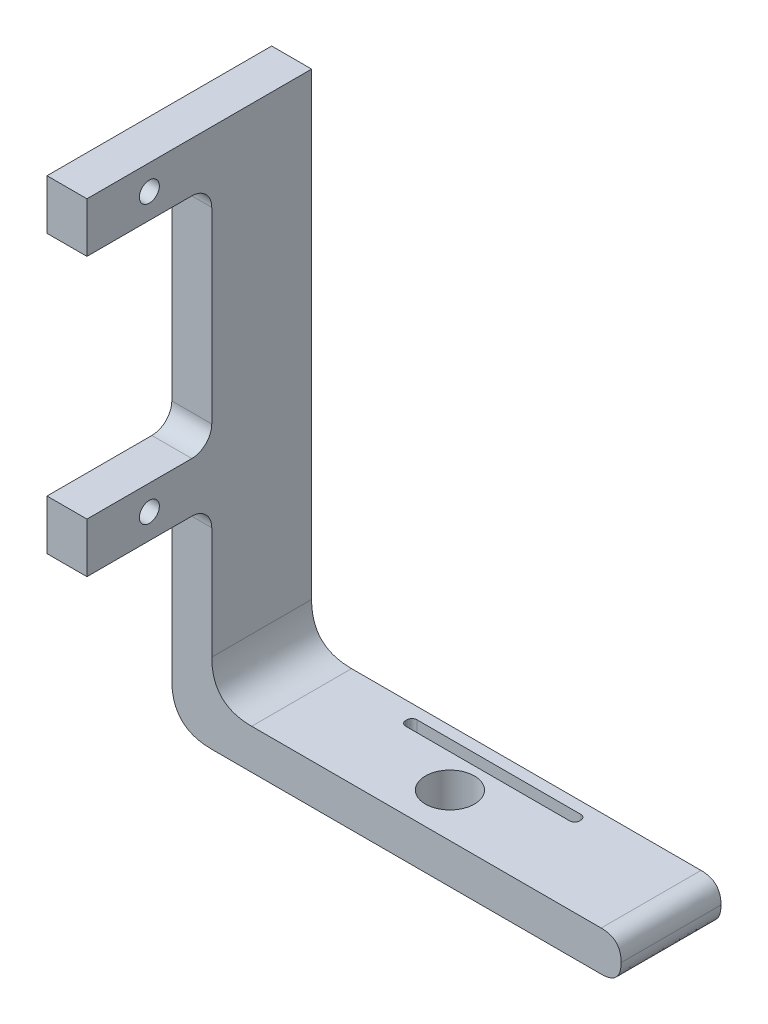
from build123d import *

# Parameters (mm, degrees)
SKETCH_1_W          = 4
SKETCH_1_H          = 50
SKETCH_1_W_2        = 45
SKETCH_1_H_2        = 4
EXTRUDE_1_DEPTH     = 10
SKETCH_2_W          = 4
SKETCH_2_H          = 5
EXTRUDE_2_DEPTH     = 12.5
SKETCH_3_R          = 1
CUT_EXTRUDE_1_DEPTH = 4
FILLET_1_DEPTH      = 10
FILLET_2_SIZE       = 4
FILLET_3_SIZE       = 2
FILLET_4_SIZE       = 2
SKETCH_27_R         = 1.552273675
CUT_EXTRUDE_2_DEPTH = 4
CUT_EXTRUDE_2_DRAFT = -7.86
FILLET_5_R          = 2
FILLET_6_R          = 2
FILLET_7_R          = 2
SKETCH_32_W         = 17.415964898
SKETCH_32_H         = 1.123035165
CUT_EXTRUDE_3_DEPTH = 4
SKETCH_26_R         = 2.45
CUT_EXTRUDE3_DEPTH  = 10
FILLET1_R           = 0.5
FILLET2_R           = 0.5
FILLET3_R           = 0.5
FILLET4_R           = 0.5


with BuildPart() as part:
    # Эскиз1 → Бобышка-Вытянуть1 (new body)
    with BuildSketch(Plane.XY):
        with Locations((2, 29)):
            Rectangle(SKETCH_1_W, SKETCH_1_H)
        with Locations((22.5, 2)):
            Rectangle(SKETCH_1_W_2, SKETCH_1_H_2)
    extrude(amount=EXTRUDE_1_DEPTH)

    # Эскиз2 → Бобышка-Вытянуть2 (add)
    with BuildSketch(Plane.XY.offset(10)):
        with Locations((2, 51.5)):
            Rectangle(SKETCH_2_W, SKETCH_2_H)
        with Locations((2, 23.72)):
            Rectangle(SKETCH_2_W, SKETCH_2_H)
    extrude(amount=EXTRUDE_2_DEPTH)

    # Эскиз3 → Вырез-Вытянуть1 (cut)
    with BuildSketch(Plane(origin=(4, 0, 0), x_dir=(0, 0, -1), z_dir=(1, 0, 0))):
        with Locations((-16.25, 51.5)):
            Circle(SKETCH_3_R)
        with Locations((-16.25, 23.72)):
            Circle(SKETCH_3_R)
    extrude(amount=-CUT_EXTRUDE_1_DEPTH, mode=Mode.SUBTRACT)

    # Скругление1: read off the stored shape, not the designer's step
    # Скругление1 outline → Скругление1 (add)
    with BuildSketch(Plane.XY):
        with BuildLine():
            Line((4, 4), (8, 4))
            add(Edge.make_bspline(
                [(8, 4), (4, 4), (4, 8)],
                knots=[0, 0, 0, 1, 1, 1], degree=2))
            Line((4, 8), (4, 4))
        make_face()
    extrude(amount=FILLET_1_DEPTH)

    # Скругление2
    # a fillet whose section is not a circle: 4 mm, written as the material it takes off along each edge
    with BuildSketch(Plane(origin=(0, 0, -10), x_dir=(0, 1, 0), z_dir=(0, 0, 1))) as fillet_2_piece_1:
        with BuildLine():
            Bezier((FILLET_2_SIZE, 0), (0, 0), (0, -FILLET_2_SIZE), weights=[1, 1, 1])
            Line((0, -FILLET_2_SIZE), (0, 0))
            Line((0, 0), (FILLET_2_SIZE, 0))
        make_face()
    extrude(amount=30, mode=Mode.SUBTRACT)

    # Скругление3
    # a fillet whose section is not a circle: 2 mm, written as the material it takes off along each edge
    with BuildSketch(Plane(origin=(45, 4, -5), x_dir=(-1, 0, 0), z_dir=(0, 0, 1))) as fillet_3_piece_1:
        with BuildLine():
            Bezier((FILLET_3_SIZE, 0), (0, 0), (0, FILLET_3_SIZE), weights=[1, 1, 1])
            Line((0, FILLET_3_SIZE), (0, 0))
            Line((0, 0), (FILLET_3_SIZE, 0))
        make_face()
    extrude(amount=20, mode=Mode.SUBTRACT)

    # Скругление4
    # a fillet whose section is not a circle: 2 mm, written as the material it takes off along each edge
    with BuildSketch(Plane(origin=(45, 0, -5), x_dir=(0, 1, 0), z_dir=(0, 0, 1))) as fillet_4_piece_1:
        with BuildLine():
            Bezier((FILLET_4_SIZE, 0), (0, 0), (0, FILLET_4_SIZE), weights=[1, 1, 1])
            Line((0, FILLET_4_SIZE), (0, 0))
            Line((0, 0), (FILLET_4_SIZE, 0))
        make_face()
    extrude(amount=20, mode=Mode.SUBTRACT)


with BuildPart() as cut_extrude_2_tool:
    # Эскиз27 → Вырез-Вытянуть2 (with draft: the straight prism first)
    with BuildSketch(Plane(origin=(0, 4, 0), x_dir=(1, 0, 0), z_dir=(0, 1, 0))):
        with Locations((23.455175104, -5.602717063)):
            Circle(SKETCH_27_R)
    extrude(amount=-CUT_EXTRUDE_2_DEPTH)
    # Вырез-Вытянуть2: the draft: its side faces are tilted about the plane it starts from
    cut_extrude_2_sides = [cut_extrude_2_tool.faces().sort_by_distance(p)[0] for p in [
        (21.902901429, 2, 5.602717063),
    ]]
    draft(cut_extrude_2_sides, Plane(origin=(0, 4, 0), x_dir=(1, 0, 0), z_dir=(0, 1, 0)), CUT_EXTRUDE_2_DRAFT)


with BuildPart() as part_1:
    add(part.part)

    # Вырез-Вытянуть2: cut by cut_extrude_2_tool
    add(cut_extrude_2_tool.part, mode=Mode.SUBTRACT)

    # Скругление5
    fillet_5_edges = [part_1.edges().sort_by_distance(p)[0] for p in [
        (2, 49, 10),
    ]]
    fillet(fillet_5_edges, radius=FILLET_5_R)

    # Скругление6
    fillet_6_edges = [part_1.edges().sort_by_distance(p)[0] for p in [
        (2, 21.22, 10),
    ]]
    fillet(fillet_6_edges, radius=FILLET_6_R)

    # Скругление7
    fillet_7_edges = [part_1.edges().sort_by_distance(p)[0] for p in [
        (2, 26.22, 10),
    ]]
    fillet(fillet_7_edges, radius=FILLET_7_R)

    # Эскиз32 → Вырез-Вытянуть3 (cut)
    with BuildSketch(Plane(origin=(0, 4, 0), x_dir=(1, 0, 0), z_dir=(0, 1, 0))):
        with Locations((23.917887929, -1.722044793)):
            Rectangle(SKETCH_32_W, SKETCH_32_H)
    extrude(amount=-CUT_EXTRUDE_3_DEPTH, mode=Mode.SUBTRACT)

    # Эскиз26 → Cut-Extrude3 (cut)
    with BuildSketch(Plane(origin=(0, 4, 0), x_dir=(1, 0, 0), z_dir=(0, 1, 0))):
        with Locations(Location((23.455175104, -5.602717063, 0), (0, 0, 270))):
            Circle(SKETCH_26_R)
    extrude(amount=-CUT_EXTRUDE3_DEPTH, mode=Mode.SUBTRACT)

    # Fillet1
    fillet1_edges = [part_1.edges().sort_by_distance(p)[0] for p in [
        (32.625870378, 2, 1.16052721),
    ]]
    fillet(fillet1_edges, radius=FILLET1_R)

    # Fillet2
    fillet2_edges = [part_1.edges().sort_by_distance(p)[0] for p in [
        (32.625870378, 2, 2.283562375),
    ]]
    fillet(fillet2_edges, radius=FILLET2_R)

    # Fillet3
    fillet3_edges = [part_1.edges().sort_by_distance(p)[0] for p in [
        (15.20990548, 2, 1.16052721),
    ]]
    fillet(fillet3_edges, radius=FILLET3_R)

    # Fillet4
    fillet4_edges = [part_1.edges().sort_by_distance(p)[0] for p in [
        (15.20990548, 2, 2.283562375),
    ]]
    fillet(fillet4_edges, radius=FILLET4_R)


solid = part_1.part
